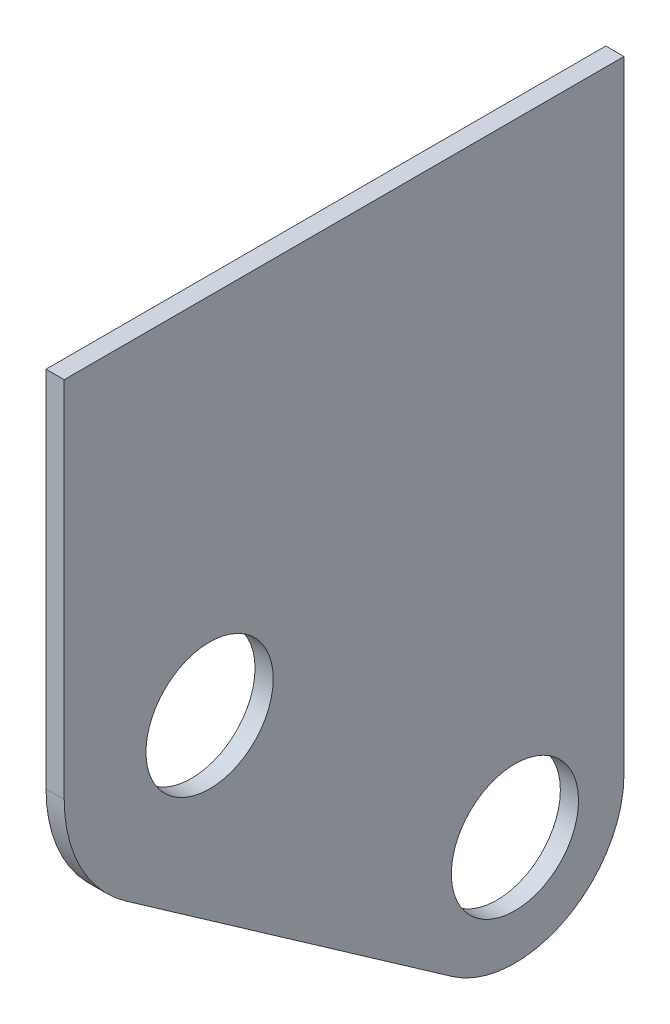
from build123d import *

# Parameters (mm, degrees)
SKETCH2_R           = 11.1125
BOSS_EXTRUDE1_DEPTH = 3.175


with BuildPart() as part:
    # Sketch2 → Boss-Extrude1 (new body)
    with BuildSketch(Plane(origin=(0, 0, 0), x_dir=(0, 0, -1), z_dir=(1, 0, 0))):
        with BuildLine():
            Line((48.89431616, 0), (-48.89431616, 0))
            Line((-48.89431616, 0), (-48.89431616, -63.5))
            ThreePointArc((-48.89431616, -63.5), (-46.024391323, -75.228414776), (-38.063157643, -84.306461925))
            Line((-38.063157643, -84.306461925), (18.917685048, -124.204877511))
            ThreePointArc((18.917685048, -124.204877511), (38.640627242, -125.497587439), (48.89431616, -108.600031067))
            Line((48.89431616, -108.600031067), (48.89431616, 0))
        make_face()
        with Locations((-23.49431616, -63.5)):
            Circle(SKETCH2_R, mode=Mode.SUBTRACT)
        with Locations((29.84431616, -108.600031067)):
            Circle(SKETCH2_R, mode=Mode.SUBTRACT)
    extrude(amount=BOSS_EXTRUDE1_DEPTH)


solid = part.part
